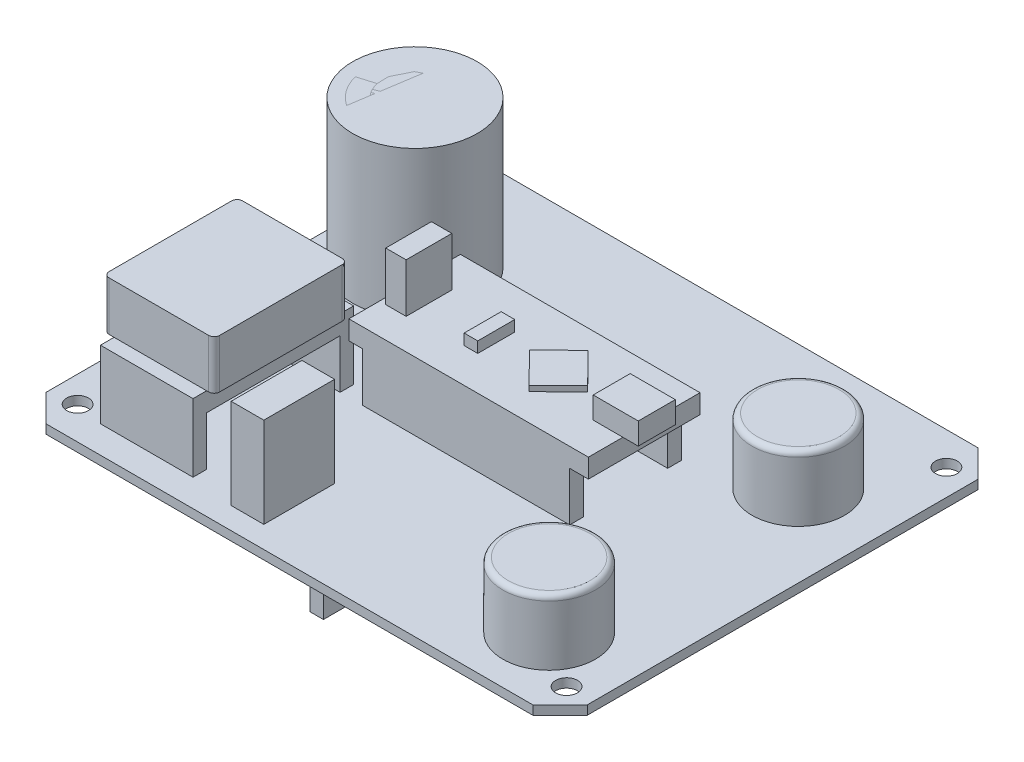
from build123d import *

# Parameters (mm, degrees)
SKETCH_1_R          = 2
EXTRUDE_1_DEPTH     = 1.66
SKETCH_1_3_W        = 38
SKETCH_1_3_H        = 2.5
SKETCH_1_3_W_2      = 17
EXTRUDE_2_DEPTH     = 9
SKETCH_1_4_W        = 6
SKETCH_1_4_H        = 13
EXTRUDE_3_DEPTH     = 16.58
SKETCH_2_R          = 9.047924982
SKETCH_2_R_2        = 5.835988173
EXTRUDE_4_DEPTH     = 27
SKETCH_2_4_R        = 5.835988173
EXTRUDE_6_DEPTH     = 27
SKETCH_1_5_R        = 11.44
EXTRUDE_7_DEPTH     = 27
SKETCH_1_6_R        = 8.5
EXTRUDE_8_DEPTH     = 12
FILLET_1_R          = 1
SKETCH_1_7_R        = 8.5
EXTRUDE_9_DEPTH     = 12
FILLET_2_R          = 1
SKETCH_4_W          = 2.5
SKETCH_4_H          = 14
SKETCH_4_W_2        = 32
SKETCH_4_H_2        = 2.5
EXTRUDE_10_DEPTH    = 9
SKETCH_4_5_W        = 9
SKETCH_4_5_H        = 12
EXTRUDE_11_DEPTH    = 11
FILLET_4_R          = 4.5
SKETCH_4_6_W        = 9
SKETCH_4_6_H        = 2
EXTRUDE_12_DEPTH    = 11
EXTRUDE_12_2_DEPTH  = 11
SKETCH_5_R          = 3
CUT_EXTRUDE_1_DEPTH = 11
SKETCH_6_R          = 1
EXTRUDE_13_DEPTH    = 8
SKETCH_7_W          = 44
SKETCH_7_H          = 20.5
SKETCH_7_W_2        = 17
SKETCH_7_H_2        = 29.5
EXTRUDE_14_DEPTH    = 3.5
EXTRUDE_15_DEPTH    = 1
SKETCH_8_3_W        = 8.276974044
SKETCH_8_3_H        = 6.797590772
EXTRUDE_16_DEPTH    = 4
SKETCH_8_4_W        = 3.741645801
SKETCH_8_4_H        = 8.39035725
EXTRUDE_17_DEPTH    = 9
SKETCH_8_5_W        = 2.494430534
SKETCH_8_5_H        = 6.797590772
EXTRUDE_18_DEPTH    = 2
SKETCH_9_W          = 20.295593889
SKETCH_9_H          = 24.5
EXTRUDE_19_DEPTH    = 9
SKETCH_10_W         = 42
SKETCH_10_H         = 41
EXTRUDE_20_DEPTH    = 1.8
SKETCH_11_W         = 25.284454957
SKETCH_11_H         = 24.944305338
EXTRUDE_21_DEPTH    = 1.8
SKETCH_12_R         = 1
EXTRUDE_22_DEPTH    = 1
FILLET_5_R          = 1


with BuildPart() as part:
    # 草图1 → 凸台-拉伸1 (new body)
    with BuildSketch(Plane(origin=(0, 0, 0), x_dir=(1, 0, 0), z_dir=(0, 1, 0))):
        Polygon((-49.7, 35.88), (-44.7, 40.88), (44.7, 40.88), (49.7, 35.88), (49.7, -35.88), (44.7, -40.88), (-44.7, -40.88), (-49.7, -35.88), align=None)
        with Locations(Location((-44.9, 34.88, 0), (0, 0, 270))):
            Circle(SKETCH_1_R, mode=Mode.SUBTRACT)
        with Locations(Location((44.9, 34.88, 0), (0, 0, 270))):
            Circle(SKETCH_1_R, mode=Mode.SUBTRACT)
        with Locations(Location((44.9, -34.88, 0), (0, 0, 270))):
            Circle(SKETCH_1_R, mode=Mode.SUBTRACT)
        with Locations(Location((-44.9, -34.88, 0), (0, 0, 270))):
            Circle(SKETCH_1_R, mode=Mode.SUBTRACT)
    extrude(amount=-EXTRUDE_1_DEPTH)

    # 草图1<3> → 凸台-拉伸2 (add)
    with BuildSketch(Plane(origin=(0, 0, 0), x_dir=(1, 0, 0), z_dir=(0, 1, 0))):
        with Locations((0.470060106, -7.63)):
            Rectangle(SKETCH_1_3_W, SKETCH_1_3_H)
        with Locations((-31.2, -34.63)):
            Rectangle(SKETCH_1_3_W_2, SKETCH_1_3_H)
        with Locations((0.470060106, 10.37)):
            Rectangle(SKETCH_1_3_W, SKETCH_1_3_H)
        with Locations((-31.2, -7.63)):
            Rectangle(SKETCH_1_3_W_2, SKETCH_1_3_H)
    extrude(amount=EXTRUDE_2_DEPTH)

    # 草图1<4> → 凸台-拉伸3 (add)
    with BuildSketch(Plane(origin=(0, 0, 0), x_dir=(1, 0, 0), z_dir=(0, 1, 0))):
        with Locations((-11.7, -30.38)):
            Rectangle(SKETCH_1_4_W, SKETCH_1_4_H)
    extrude(amount=EXTRUDE_3_DEPTH)

    # 草图2 → 凸台-拉伸4 (add)
    with BuildSketch(Plane(origin=(0, 0, 0), x_dir=(1, 0, 0), z_dir=(0, 1, 0))):
        with Locations(Location((-35.7, 17.88, 0), (0, 0, 90))):
            Circle(SKETCH_2_R)
        with Locations(Location((-35.7, 17.88, 0), (0, 0, 270))):
            Circle(SKETCH_2_R_2, mode=Mode.SUBTRACT)
    extrude(amount=EXTRUDE_4_DEPTH)

    # 草图1<6> → 凸台-拉伸8 (add)
    with BuildSketch(Plane(origin=(0, 0, 0), x_dir=(1, 0, 0), z_dir=(0, 1, 0))):
        with Locations(Location((34.7, 17.88, 0), (0, 0, 90))):
            Circle(SKETCH_1_6_R)
    extrude(amount=EXTRUDE_8_DEPTH)

    # 圆角1
    fillet_1_edges = [part.edges().sort_by_distance(p)[0] for p in [
        (34.7, 12, -9.38),
    ]]
    fillet(fillet_1_edges, radius=FILLET_1_R)

    # 草图1<7> → 凸台-拉伸9 (add)
    with BuildSketch(Plane(origin=(0, 0, 0), x_dir=(1, 0, 0), z_dir=(0, 1, 0))):
        with Locations(Location((34.7, -27.88, 0), (0, 0, 90))):
            Circle(SKETCH_1_7_R)
    extrude(amount=EXTRUDE_9_DEPTH)

    # 圆角2
    fillet_2_edges = [part.edges().sort_by_distance(p)[0] for p in [
        (34.7, 12, 36.38),
    ]]
    fillet(fillet_2_edges, radius=FILLET_2_R)

    # 草图4 → 凸台-拉伸10 (add)
    with BuildSketch(Plane.XZ.offset(1.66)):
        with Locations((0, 28.88)):
            Rectangle(SKETCH_4_W, SKETCH_4_H)
        with Locations((0, -19.87)):
            Rectangle(SKETCH_4_W_2, SKETCH_4_H_2)
        with Locations((0, 18.63)):
            Rectangle(SKETCH_4_W_2, SKETCH_4_H_2)
    extrude(amount=EXTRUDE_10_DEPTH)

    # 草图4<5> → 凸台-拉伸11 (add)
    with BuildSketch(Plane.XZ.offset(1.66)):
        with Locations((-22.5, -31.88)):
            Rectangle(SKETCH_4_5_W, SKETCH_4_5_H)
        with Locations((22.5, -31.88)):
            Rectangle(SKETCH_4_5_W, SKETCH_4_5_H)
    extrude(amount=EXTRUDE_11_DEPTH)

    # 圆角4
    fillet_4_edges = [part.edges().sort_by_distance(p)[0] for p in [
        (27, -12.66, -31.88),
        (18, -12.66, -31.88),
        (-18, -12.66, -31.88),
        (-27, -12.66, -31.88),
    ]]
    fillet(fillet_4_edges, radius=FILLET_4_R - 0.0001)  # a hair under: the kernel refuses the full size


with BuildPart() as body_2:
    # 草图2<4> → 凸台-拉伸6 (new body)
    with BuildSketch(Plane(origin=(0, 0, 0), x_dir=(1, 0, 0), z_dir=(0, 1, 0))):
        with Locations(Location((-35.7, 17.88, 0), (0, 0, 270))):
            Circle(SKETCH_2_4_R)
    extrude(amount=EXTRUDE_6_DEPTH)


with BuildPart() as body_3:
    # 草图1<5> → 凸台-拉伸7 (new body)
    with BuildSketch(Plane(origin=(0, 0, 0), x_dir=(1, 0, 0), z_dir=(0, 1, 0))):
        with Locations(Location((-35.7, 17.88, 0), (0, 0, 270))):
            Circle(SKETCH_1_5_R)
    extrude(amount=EXTRUDE_7_DEPTH)


with BuildPart() as body_4:
    # 草图4<6> → 凸台-拉伸12 (new body)
    with BuildSketch(Plane.XZ.offset(1.66)):
        with Locations((-22.5, -24.88)):
            Rectangle(SKETCH_4_6_W, SKETCH_4_6_H)
    extrude(amount=EXTRUDE_12_DEPTH)


with BuildPart() as body_5:
    # 草图4<6> → Extrude 12 2 (new body)
    with BuildSketch(Plane.XZ.offset(1.66)):
        with Locations((22.5, -24.88)):
            Rectangle(SKETCH_4_6_W, SKETCH_4_6_H)
    extrude(amount=EXTRUDE_12_2_DEPTH)


with BuildPart() as cut_extrude_1_tool:
    # 草图5 → 切除-拉伸1 (new body)
    with BuildSketch(Plane.XY.offset(-23.88)):
        with Locations((-22.5, -7.16)):
            Circle(SKETCH_5_R)
        with Locations((22.5, -7.16)):
            Circle(SKETCH_5_R)
    extrude(amount=-CUT_EXTRUDE_1_DEPTH)


with BuildPart() as part_1:
    add(part.part)

    # 切除-拉伸1: cut by cut_extrude_1_tool
    add(cut_extrude_1_tool.part, mode=Mode.SUBTRACT)

    # 草图6 → 凸台-拉伸13 (add)
    with BuildSketch(Plane.XY.offset(-34.88)):
        with Locations((-22.5, -7.16)):
            Circle(SKETCH_6_R)
        with Locations((22.5, -7.16)):
            Circle(SKETCH_6_R)
    extrude(amount=EXTRUDE_13_DEPTH)

    # 草图7 → 凸台-拉伸14 (add)
    with BuildSketch(Plane(origin=(0, 9, 0), x_dir=(1, 0, 0), z_dir=(0, 1, 0))):
        with Locations((0.910723668, 1.37)):
            Rectangle(SKETCH_7_W, SKETCH_7_H)
        with Locations((-31.2, -21.13)):
            Rectangle(SKETCH_7_W_2, SKETCH_7_H_2)
    extrude(amount=EXTRUDE_14_DEPTH)

    # 草图8 → 凸台-拉伸15 (add)
    with BuildSketch(Plane(origin=(0, 12.5, 0), x_dir=(1, 0, 0), z_dir=(0, 1, 0))):
        Polygon((1.473981679, 1.757439694), (7.035612597, -3.922523796), (12.478006489, 1.40648689), (6.916375571, 7.08645038), align=None)
    extrude(amount=EXTRUDE_15_DEPTH)

    # 草图8<5> → 凸台-拉伸18 (add)
    with BuildSketch(Plane(origin=(0, 12.5, 0), x_dir=(1, 0, 0), z_dir=(0, 1, 0))):
        with Locations((-4.988861068, 0.847673249)):
            Rectangle(SKETCH_8_5_W, SKETCH_8_5_H)
    extrude(amount=EXTRUDE_18_DEPTH)

    # 草图10 → 凸台-拉伸20 (add)
    with BuildSketch(Plane(origin=(0, -10.66, 0), x_dir=(-1, 0, 0), z_dir=(0, -1, 0))):
        with Locations((-0.42942595, 0.62)):
            Rectangle(SKETCH_10_W, SKETCH_10_H)
    extrude(amount=EXTRUDE_20_DEPTH)

    # 草图11 → 凸台-拉伸21 (add)
    with BuildSketch(Plane.XZ.offset(12.46)):
        with Locations((-1.077140458, -2.891271755)):
            Rectangle(SKETCH_11_W, SKETCH_11_H)
    extrude(amount=EXTRUDE_21_DEPTH)

    # 草图12 → 凸台-拉伸22 (add)
    with BuildSketch(Plane(origin=(0, -12.46, 0), x_dir=(-1, 0, 0), z_dir=(0, -1, 0))):
        with Locations(Location((-18.027929767, 17.177555722, 0), (0, 0, 90))):
            Circle(SKETCH_12_R)
    extrude(amount=EXTRUDE_22_DEPTH)


with BuildPart() as body_4_1:
    add(body_4.part)

    # 切除-拉伸1: cut by cut_extrude_1_tool
    add(cut_extrude_1_tool.part, mode=Mode.SUBTRACT)


with BuildPart() as body_5_1:
    add(body_5.part)

    # 切除-拉伸1: cut by cut_extrude_1_tool
    add(cut_extrude_1_tool.part, mode=Mode.SUBTRACT)


with BuildPart() as body_6:
    # 草图8<3> → 凸台-拉伸16 (new body)
    with BuildSketch(Plane(origin=(0, 12.5, 0), x_dir=(1, 0, 0), z_dir=(0, 1, 0))):
        with Locations((21.599500759, 0.847673249)):
            Rectangle(SKETCH_8_3_W, SKETCH_8_3_H)
    extrude(amount=EXTRUDE_16_DEPTH)


with BuildPart() as body_7:
    # 草图8<4> → 凸台-拉伸17 (new body)
    with BuildSketch(Plane(origin=(0, 12.5, 0), x_dir=(1, 0, 0), z_dir=(0, 1, 0))):
        with Locations((-18.084621371, 0.963757252)):
            Rectangle(SKETCH_8_4_W, SKETCH_8_4_H)
    extrude(amount=EXTRUDE_17_DEPTH)


with BuildPart() as body_8:
    # 草图9 → 凸台-拉伸19 (new body)
    with BuildSketch(Plane(origin=(0, 12.5, 0), x_dir=(1, 0, 0), z_dir=(0, 1, 0))):
        with Locations((-31.463839689, -21.13)):
            Rectangle(SKETCH_9_W, SKETCH_9_H)
    extrude(amount=EXTRUDE_19_DEPTH)

    # 圆角5
    fillet_5_edges = [body_8.edges().sort_by_distance(p)[0] for p in [
        (-41.611636633, 17, 8.88),
        (-21.316042744, 17, 8.88),
        (-21.316042744, 17, 33.38),
        (-41.611636633, 17, 33.38),
    ]]
    fillet(fillet_5_edges, radius=FILLET_5_R)


solid = Compound([body_2.part, body_3.part, part_1.part, body_4_1.part, body_5_1.part, body_6.part, body_7.part, body_8.part])
